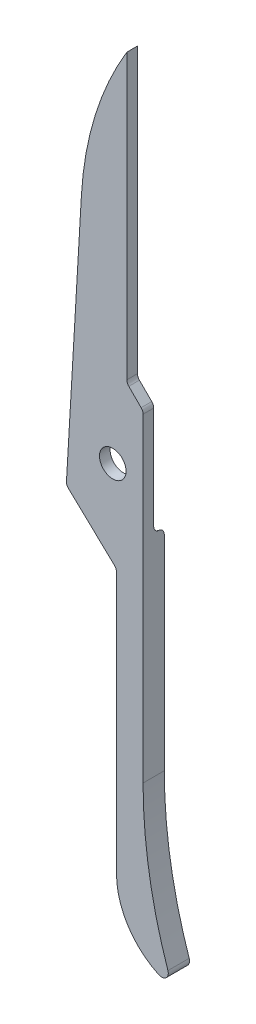
from build123d import *

# Parameters (mm, degrees)
BOSS_EXTRUDE1_DEPTH = 1.6
SKETCH2_R           = 1
CUT_EXTRUDE1_DEPTH  = 60.868490043
FILLET1_R           = 0.5
CUT_EXTRUDE3_DEPTH  = 0.8
FILLET2_R           = 0.4


with BuildPart() as part:
    # Sketch1 → Boss-Extrude1 (new body)
    with BuildSketch(Plane.XY):
        with BuildLine():
            Line((3.78, 5.348981211), (3.78, 25.241675085))
            Line((3.78, 25.241675085), (0, 28.81))
            Line((0, 28.81), (1.140731522, 48.297942259))
            ThreePointArc((1.140731522, 48.297942259), (2.179202609, 54.012368785), (4.56, 59.31))
            Line((4.56, 59.31), (4.56, 37.74))
            Line((4.56, 37.74), (5.78, 36.52))
            Line((5.78, 36.52), (5.78, 12.266686594))
            ThreePointArc((5.78, 12.266686594), (6.339471549, 6.033709777), (8, 0))
            ThreePointArc((8, 0), (4.962014359, 1.942369992), (3.78, 5.348981211))
        make_face()
    extrude(amount=BOSS_EXTRUDE1_DEPTH)

    # Sketch2 → Cut-Extrude1 (cut, through all)
    with BuildSketch(Plane.XY.offset(1.6)):
        with Locations((3.5, 31.95)):
            Circle(SKETCH2_R)
    extrude(amount=-CUT_EXTRUDE1_DEPTH, mode=Mode.SUBTRACT)

    # Fillet1
    fillet1_edges = [part.edges().sort_by_distance(p)[0] for p in [
        (3.78, 25.241675085, 0.8),
        (0, 28.81, 0.8),
        (4.56, 37.74, 0.8),
        (5.78, 36.52, 0.8),
        (8, 0, 0.8),
    ]]
    fillet(fillet1_edges, radius=FILLET1_R)

    # Sketch8 → Cut-Extrude3 (cut)
    with BuildSketch(Plane(origin=(0, 0, 0), x_dir=(-1, 0, 0), z_dir=(0, 0, -1))):
        Polygon((-2.943771792, 26.031075601), (11.550433579, 26.031075601), (11.550433579, 65.314635105), (-14.375020628, 65.314635105), (-14.375020628, 34.529960463), align=None)
    extrude(amount=-CUT_EXTRUDE3_DEPTH, mode=Mode.SUBTRACT)

    # Fillet2
    fillet2_edges = [part.edges().sort_by_distance(p)[0] for p in [
        (4.361885896, 27.085412591, 0.8),
        (4.361885896, 27.085412591, 0),
    ]]
    fillet(fillet2_edges, radius=FILLET2_R - 0.0001)  # a hair under: the kernel refuses the full size


solid = part.part
